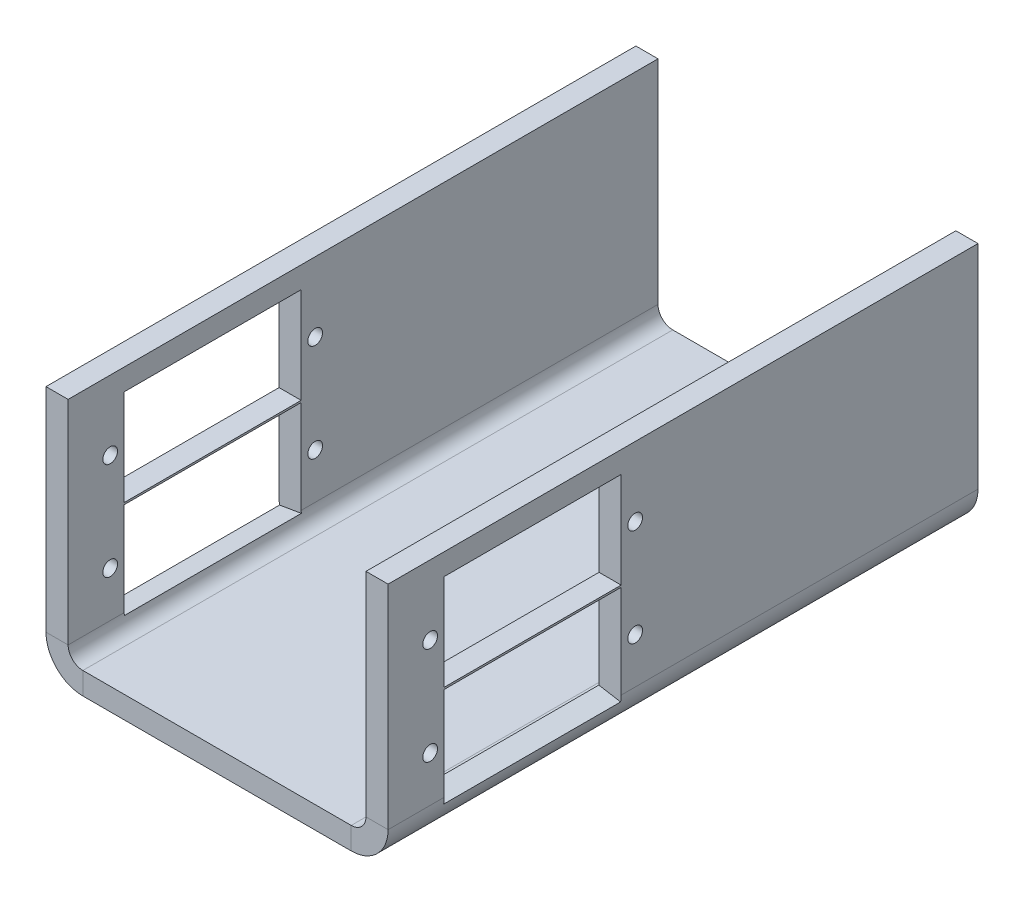
from build123d import *

# Parameters (mm, degrees)
BASE_FLANGE1_DEPTH       = 80
CUT_EXTRUDE1_START       = 48.39544582
CUT_EXTRUDE1_OUTLINE_W   = 3
CUT_EXTRUDE1_OUTLINE_H   = 13
CUT_EXTRUDE1_DEPTH       = 24
CUT_EXTRUDE1_START_2     = -46.394569282
CUT_EXTRUDE1_2_OUTLINE_R = 1
CUT_EXTRUDE1_2_DEPTH     = 46.394569282


# Read off the part's stored shape, not the designer's step: Cut-Extrude1
# Sheet-metal steps are written as plain solids
with BuildPart() as part:
    # Sketch1 → Base-Flange1 (new body)
    with BuildSketch(Plane.XY):
        with BuildLine():
            Line((23.197284641, 47.603861413), (23.197284641, 18.763363208))
            ThreePointArc((23.197284641, 18.763363208), (21.732818547, 15.227829302), (18.197284641, 13.763363208))
            Line((18.197284641, 13.763363208), (-18.197284641, 13.763363208))
            ThreePointArc((-18.197284641, 13.763363208), (-21.732818547, 15.227829302), (-23.197284641, 18.763363208))
            Line((-23.197284641, 18.763363208), (-23.197284641, 47.603861413))
            Line((-23.197284641, 47.603861413), (-20.197284641, 47.603861413))
            Line((-20.197284641, 47.603861413), (-20.197284641, 18.763363208))
            ThreePointArc((-20.197284641, 18.763363208), (-19.611498203, 17.349149646), (-18.197284641, 16.763363208))
            Line((-18.197284641, 16.763363208), (18.197284641, 16.763363208))
            ThreePointArc((18.197284641, 16.763363208), (19.611498203, 17.349149646), (20.197284641, 18.763363208))
            Line((20.197284641, 18.763363208), (20.197284641, 47.603861413))
            Line((20.197284641, 47.603861413), (23.197284641, 47.603861413))
        make_face()
    extrude(amount=BASE_FLANGE1_DEPTH)

    # Cut-Extrude1 outline → Cut-Extrude1 (cut)
    with BuildSketch(Plane.XY.offset(CUT_EXTRUDE1_START)):
        with BuildLine():
            Line((-20.197284641, 18.763363208), (-20.197284641, 31.428624583))
            Line((-20.197284641, 31.428624583), (-23.197284641, 31.428624583))
            Line((-23.197284641, 31.428624583), (-23.197284641, 18.763363208))
            ThreePointArc((-23.197284641, 18.763363208), (-23.17962128, 18.343456534), (-23.126755995, 17.926516645))
            Line((-23.126755995, 17.926516645), (-20.169073182, 18.428624583))
            ThreePointArc((-20.169073182, 18.428624583), (-20.190219297, 18.595400538), (-20.197284641, 18.763363208))
        make_face()
        with Locations((-21.697284641, 38.186330489)):
            Rectangle(CUT_EXTRUDE1_OUTLINE_W, CUT_EXTRUDE1_OUTLINE_H)
        with BuildLine():
            Line((23.197284641, 18.763363208), (23.197284641, 31.428624583))
            Line((23.197284641, 31.428624583), (20.197284641, 31.428624583))
            Line((20.197284641, 31.428624583), (20.197284641, 18.763363208))
            ThreePointArc((20.197284641, 18.763363208), (20.190219297, 18.595400538), (20.169073182, 18.428624583))
            Line((20.169073182, 18.428624583), (23.126755995, 17.926516645))
            ThreePointArc((23.126755995, 17.926516645), (23.17962128, 18.343456534), (23.197284641, 18.763363208))
        make_face()
        with Locations((21.697284641, 38.186330489)):
            Rectangle(CUT_EXTRUDE1_OUTLINE_W, CUT_EXTRUDE1_OUTLINE_H)
    extrude(amount=CUT_EXTRUDE1_DEPTH, mode=Mode.SUBTRACT)

    # Cut-Extrude1 2 outline → Cut-Extrude1 2 (cut)
    with BuildSketch(Plane.ZY.offset(23.197284641).offset(CUT_EXTRUDE1_START_2)):
        with Locations((74.29544582, 24.928624583)):
            Circle(CUT_EXTRUDE1_2_OUTLINE_R)
        with Locations((46.49544582, 24.928624583)):
            Circle(CUT_EXTRUDE1_2_OUTLINE_R)
        with Locations((74.29544582, 38.186330489)):
            Circle(CUT_EXTRUDE1_2_OUTLINE_R)
        with Locations((46.49544582, 38.186330489)):
            Circle(CUT_EXTRUDE1_2_OUTLINE_R)
    extrude(amount=CUT_EXTRUDE1_2_DEPTH, mode=Mode.SUBTRACT)


solid = part.part
